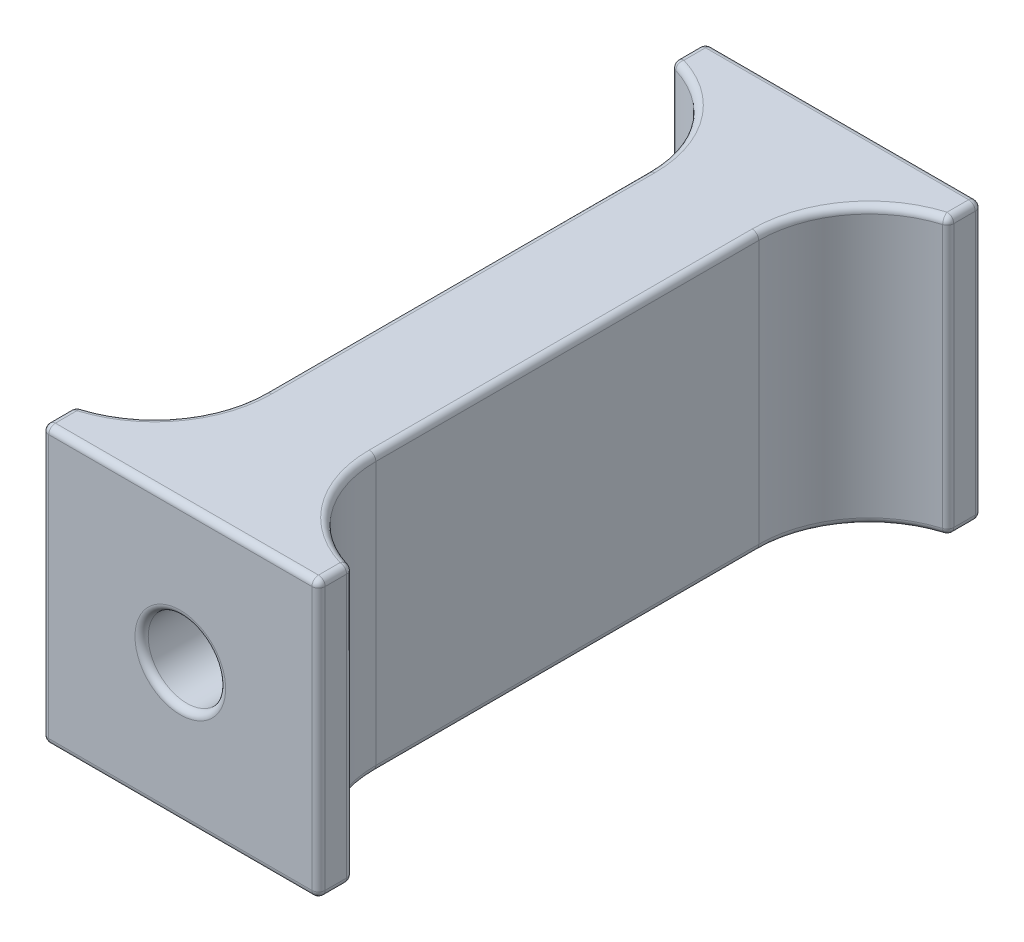
from build123d import *

# Parameters (mm, degrees)
SALIENTE_EXTRUIR1_DEPTH = 25
CROQUIS2_R              = 3.5
CORTAR_EXTRUIR1_DEPTH   = 67.191011474
REDONDEO1_R             = 10
REDONDEO2_R             = 0.6


with BuildPart() as part:
    # Croquis1 → Saliente-Extruir1 (new body)
    with BuildSketch(Plane(origin=(0, 0, 0), x_dir=(1, 0, 0), z_dir=(0, 1, 0))):
        Polygon((0, 0), (12.5, 0), (12.5, 3), (5, 3), (5, 30), (0, 30), align=None)
    saliente_extruir1 = extrude(amount=SALIENTE_EXTRUIR1_DEPTH)

    # Simetría1: Saliente-Extruir1 across plane
    add(saliente_extruir1.mirror(Plane(origin=(0, 25, -30), x_dir=(0, 0, 1), z_dir=(1, 0, 0))))

    # Simetría8: part across plane


with BuildPart() as part_1:
    add(part.part)
    add(part.part.mirror(Plane(origin=(5, 25, -30), x_dir=(1, 0, 0), z_dir=(0, 0, 1))))

    # Croquis2 → Cortar-Extruir1 (cut, through all)
    with BuildSketch(Plane(origin=(0, 0, -60), x_dir=(-1, 0, 0), z_dir=(0, 0, -1))):
        with Locations((0, 12.5)):
            Circle(CROQUIS2_R)
    extrude(amount=-CORTAR_EXTRUIR1_DEPTH, mode=Mode.SUBTRACT)

    # Redondeo1
    # the kernel refuses this fillet: 10 mm, written as the material it adds along each edge
    with BuildSketch(Plane(origin=(5, 0, -57), x_dir=(0, 0, 1), z_dir=(0, 1, 0)), Plane(origin=(-5, 0, -3), x_dir=(0, 0, -1), z_dir=(0, 1, 0))) as redondeo1_piece_1:
        with BuildLine():
            CenterArc((9.682458366, 10), REDONDEO1_R, 194.477512186, 75.522487814)
            Line((0, 7.5), (-0.193649167, 7.45))
            ThreePointArc((-0.193649167, 7.45), (-0.2, 3.75), (-0.2, 0))
            Line((-0.2, 0), (0, -0.2))
            Line((0, -0.2), (9.682458366, -0.2))
            Line((9.682458366, -0.2), (9.682458366, 0))
        make_face()
    extrude(amount=25)
    with BuildSketch(Plane(origin=(-5, 0, -57), x_dir=(-1, 0, 0), z_dir=(0, 1, 0)), Plane(origin=(5, 0, -3), x_dir=(1, 0, 0), z_dir=(0, 1, 0))) as redondeo1_piece_2:
        with BuildLine():
            CenterArc((10, 9.682458366), REDONDEO1_R, 180, 75.522487814)
            Line((0, 9.682458366), (-0.2, 9.682458366))
            Line((-0.2, 9.682458366), (-0.2, 0))
            Line((-0.2, 0), (0, -0.2))
            ThreePointArc((0, -0.2), (3.75, -0.2), (7.45, -0.193649167))
            Line((7.45, -0.193649167), (7.5, 0))
        make_face()
    extrude(amount=25)

    # Redondeo2
    redondeo2_edges = [part_1.edges().sort_by_distance(p)[0] for p in [
        (12.5, 12.5, -3),
        (12.5, 12.5, 0),
        (12.5, 25, -1.5),
        (-12.5, 25, -1.5),
        (-12.5, 12.5, -3),
        (-12.5, 12.5, 0),
        (-12.5, 0, -1.5),
        (0, 25, -60),
        (12.5, 12.5, -60),
        (12.5, 25, -58.5),
        (12.5, 12.5, -57),
        (-12.5, 25, -58.5),
        (0, 0, -60),
        (12.5, 0, -58.5),
        (-12.5, 12.5, -57),
        (-12.5, 0, -58.5),
        (-12.5, 12.5, -60),
        (3.5, 12.5, 0),
        (3.5, 12.5, -60),
        (-5, 0, -30),
        (-5, 25, -30),
        (5, 0, -30),
        (5, 25, -30),
        (-7.09430585, 0, -6.558734009),
        (-7.09430585, 25, -6.558734009),
        (7.09430585, 0, -6.558734009),
        (7.09430585, 25, -6.558734009),
        (7.09430585, 0, -53.441265991),
        (7.09430585, 25, -53.441265991),
        (-7.09430585, 0, -53.441265991),
        (-7.09430585, 25, -53.441265991),
        (12.5, 0, -1.5),
        (0, 0, 0),
        (0, 25, 0),
    ]]
    fillet(redondeo2_edges, radius=REDONDEO2_R)


solid = part_1.part
